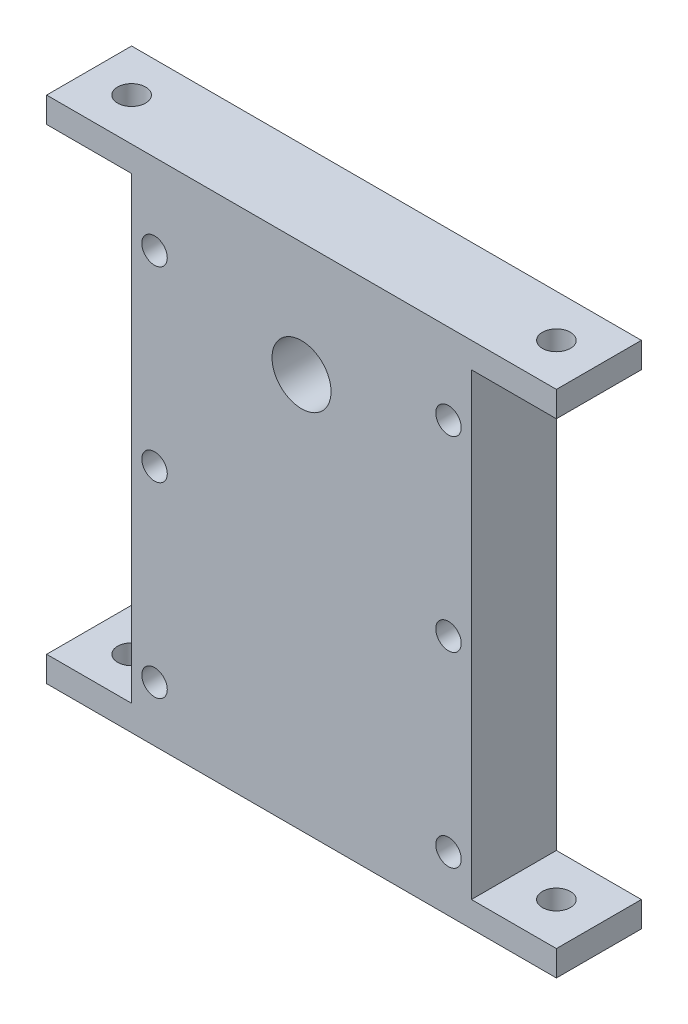
from build123d import *

# Parameters (mm, degrees)
SKETCH1_W                    = 40
SKETCH1_H                    = 60
SKETCH1_R                    = 3.475
SKETCH1_R_2                  = 1.5
BOSS_EXTRUDE1_DEPTH          = 10
ESQUISSE1_W                  = 10
ESQUISSE1_H                  = 3
BOSS_EXTRU_1_DEPTH           = 10
ESQUISSE2_W                  = 10
ESQUISSE2_H                  = 3
BOSS_EXTRU_2_DEPTH           = 10
ENL_V_MAT_EXTRU_1_DEPTH      = 66.184353951
ENL_V_MAT_EXTRU_1_DEPTH_BACK = 66.184353951
ESQUISSE3_R                  = 1.65


with BuildPart() as part:
    # Sketch1 → Boss-Extrude1 (new body)
    with BuildSketch(Plane.XY):
        Rectangle(SKETCH1_W, SKETCH1_H)
        with Locations((0, 16.5)):
            Circle(SKETCH1_R, mode=Mode.SUBTRACT)
        with Locations((-17.3, -1.5)):
            Circle(SKETCH1_R_2, mode=Mode.SUBTRACT)
        with Locations((-17.3, 20.5)):
            Circle(SKETCH1_R_2, mode=Mode.SUBTRACT)
        with Locations((17.3, -1.5)):
            Circle(SKETCH1_R_2, mode=Mode.SUBTRACT)
        with Locations((17.3, 20.5)):
            Circle(SKETCH1_R_2, mode=Mode.SUBTRACT)
        with Locations((-17.3, -23.5)):
            Circle(SKETCH1_R_2, mode=Mode.SUBTRACT)
        with Locations((17.3, -23.5)):
            Circle(SKETCH1_R_2, mode=Mode.SUBTRACT)
    extrude(amount=BOSS_EXTRUDE1_DEPTH)

    # Esquisse1 → Boss.-Extru.1 (add)
    with BuildSketch(Plane(origin=(20, 0, 0), x_dir=(0, 0, -1), z_dir=(1, 0, 0))):
        with Locations((-5, 28.5)):
            Rectangle(ESQUISSE1_W, ESQUISSE1_H)
        with Locations((-5, -28.5)):
            Rectangle(ESQUISSE1_W, ESQUISSE1_H)
    extrude(amount=BOSS_EXTRU_1_DEPTH)

    # Esquisse2 → Boss.-Extru.2 (add)
    with BuildSketch(Plane.ZY.offset(20)):
        with Locations((5, 28.5)):
            Rectangle(ESQUISSE2_W, ESQUISSE2_H)
        with Locations((5, -28.5)):
            Rectangle(ESQUISSE2_W, ESQUISSE2_H)
    extrude(amount=BOSS_EXTRU_2_DEPTH)

    # Esquisse3 → Enlèv. mat.-Extru.1 (cut, two sides: drawn at the far end of the back side and taken through both)
    with BuildSketch(Plane.XZ.offset(-27).offset(-ENL_V_MAT_EXTRU_1_DEPTH_BACK)):
        with Locations((-25, 5)):
            Circle(ESQUISSE3_R)
        with Locations((25, 5)):
            Circle(ESQUISSE3_R)
    extrude(amount=ENL_V_MAT_EXTRU_1_DEPTH + ENL_V_MAT_EXTRU_1_DEPTH_BACK, mode=Mode.SUBTRACT)


solid = part.part
